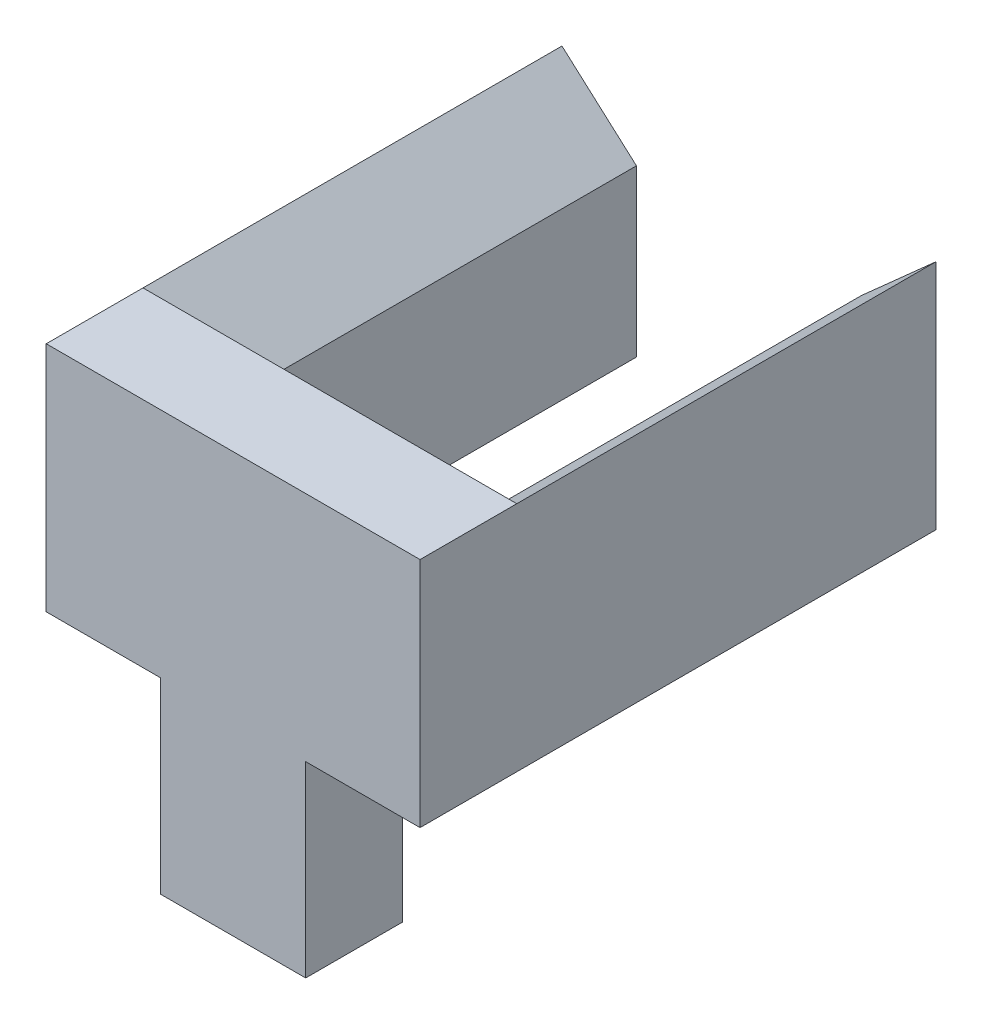
from build123d import *

# Parameters (mm, degrees)
SKETCH1_W           = 38.1
SKETCH1_H           = 25.4
BOSS_EXTRUDE1_DEPTH = 110.1598
SKETCH2_W           = 25.4
SKETCH2_H           = 60.96
BOSS_EXTRUDE2_DEPTH = 30.0228
SKETCH3_W           = 25.4
SKETCH3_H           = 60.96
BOSS_EXTRUDE3_DEPTH = 30.0228
BOSS_EXTRUDE4_DEPTH = 110.0074
BOSS_EXTRUDE5_DEPTH = 110.0074
SKETCH8_R           = 3.81
CUT_EXTRUDE1_DEPTH  = 25.4


with BuildPart() as part:
    # Sketch1 → Boss-Extrude1 (new body)
    with BuildSketch(Plane(origin=(0, 0, 0), x_dir=(1, 0, 0), z_dir=(0, 1, 0))):
        with Locations((5.061883246, 0.142486096)):
            Rectangle(SKETCH1_W, SKETCH1_H)
    extrude(amount=BOSS_EXTRUDE1_DEPTH)

    # Sketch2 → Boss-Extrude2 (add)
    with BuildSketch(Plane(origin=(24.111883246, 0, 0), x_dir=(0, 0, -1), z_dir=(1, 0, 0))):
        with Locations((0.142486096, 79.6798)):
            Rectangle(SKETCH2_W, SKETCH2_H)
    extrude(amount=BOSS_EXTRUDE2_DEPTH)

    # Sketch3 → Boss-Extrude3 (add)
    with BuildSketch(Plane.ZY.offset(13.988116754)):
        with Locations((-0.142486096, 79.6798)):
            Rectangle(SKETCH3_W, SKETCH3_H)
    extrude(amount=BOSS_EXTRUDE3_DEPTH)

    # Sketch4 → Boss-Extrude4 (add)
    with BuildSketch(Plane(origin=(0, 0, -12.842486096), x_dir=(-1, 0, 0), z_dir=(0, 0, -1))):
        Polygon((-54.134683246, 110.1598), (-54.134683246, 49.1998), (-34.576683246, 49.1998), (-34.576683246, 92.699799868), align=None)
    extrude(amount=BOSS_EXTRUDE4_DEPTH)

    # Sketch5 → Boss-Extrude5 (add)
    with BuildSketch(Plane(origin=(0, 0, -12.842486096), x_dir=(-1, 0, 0), z_dir=(0, 0, -1))):
        Polygon((44.010916754, 110.1598), (44.010916754, 49.1998), (24.452916754, 49.1998), (24.452916754, 92.699799899), align=None)
    extrude(amount=BOSS_EXTRUDE5_DEPTH)

    # Sketch8 → Cut-Extrude1 (cut)
    with BuildSketch(Plane.XZ):
        with Locations((-4.938116754, -0.142486096)):
            Circle(SKETCH8_R)
        with Locations((15.061883246, -0.142486096)):
            Circle(SKETCH8_R)
    extrude(amount=-CUT_EXTRUDE1_DEPTH, mode=Mode.SUBTRACT)


solid = part.part
